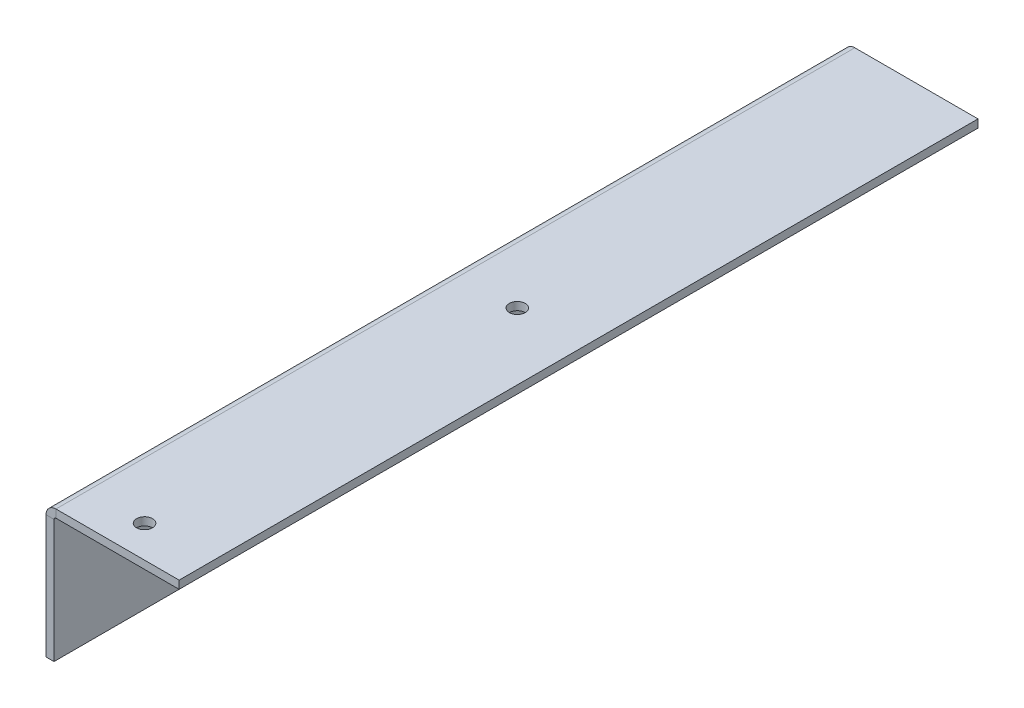
from build123d import *

# Parameters (mm, degrees)
BASE_FLANGE1_DEPTH = 300
SKETCH6_R          = 3
CUT_EXTRUDE1_DEPTH = 10


# Sheet-metal steps are written as plain solids
with BuildPart() as part:
    # Sketch1 → Base-Flange1 (new body)
    with BuildSketch(Plane.XY):
        with BuildLine():
            Line((0, 0), (0, 46.2634))
            ThreePointArc((0, 46.2634), (1.094424801, 48.905575199), (3.7366, 50))
            Line((3.7366, 50), (50, 50))
            Line((50, 50), (50, 47))
            Line((50, 47), (3.7366, 47))
            ThreePointArc((3.7366, 47), (3.215745145, 46.784254855), (3, 46.2634))
            Line((3, 46.2634), (3, 0))
            Line((3, 0), (0, 0))
        make_face()
    extrude(amount=BASE_FLANGE1_DEPTH)

    # Sketch6 → Cut-Extrude1 (cut)
    with BuildSketch(Plane(origin=(0, 50, 0), x_dir=(1, 0, 0), z_dir=(0, 1, 0))):
        with Locations(Location((25, -288, 0), (0, 0, 270))):
            Circle(SKETCH6_R)
        with Locations(Location((25, -148, 0), (0, 0, 270))):
            Circle(SKETCH6_R)
    extrude(amount=-CUT_EXTRUDE1_DEPTH, mode=Mode.SUBTRACT)


solid = part.part
